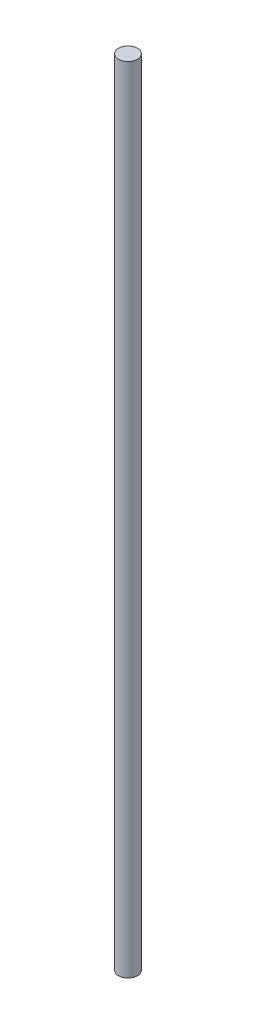
from build123d import *

# Parameters (mm, degrees)
SKETCH1_R           = 3
BOSS_EXTRUDE1_DEPTH = 125


with BuildPart() as part:
    # Sketch1 → Boss-Extrude1 (new, symmetric)
    with BuildSketch(Plane(origin=(0, 0, 0), x_dir=(1, 0, 0), z_dir=(0, 1, 0))):
        Circle(SKETCH1_R)
    extrude(amount=BOSS_EXTRUDE1_DEPTH, both=True)


solid = part.part
